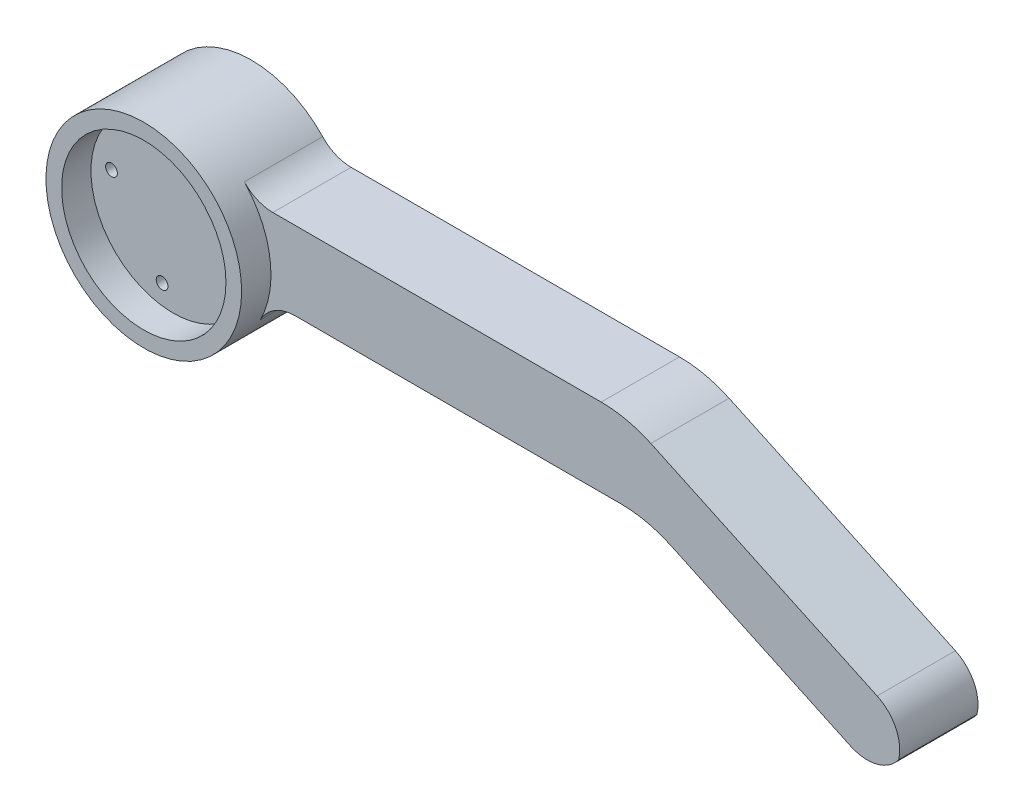
from build123d import *

# Parameters (mm, degrees)
BOSS_EXTRU_1_DEPTH  = 5
CONG_4_R            = 5
CONG_3_R            = 15
CONG_6_R            = 5
SKETCH4_R           = 0.75
CUT_EXTRUDE5_DEPTH  = 95.659933807
BOSS_EXTRUDE1_START = -13.75
SKETCH5_R           = 12.5
SKETCH5_R_2         = 10.5
BOSS_EXTRUDE1_DEPTH = 3.75


with BuildPart() as part:
    # Esquisse1 → Boss.-Extru.1 (new, symmetric)
    with BuildSketch(Plane.XY):
        with BuildLine():
            Line((10.356157589, 7), (58.01560049, 7))
            Line((58.01560049, 7), (94.472218138, -10))
            Line((94.472218138, -10), (91.091272045, -17.250462296))
            Line((91.091272045, -17.250462296), (60.53105703, -3))
            Line((60.53105703, -3), (12.1346611, -3))
            ThreePointArc((12.1346611, -3), (-12.306877399, -2.188782466), (10.356157589, 7))
        make_face()
    extrude(amount=BOSS_EXTRU_1_DEPTH, both=True)

    # Congé4
    cong_4_edges = [part.edges().sort_by_distance(p)[0] for p in [
        (12.1346611, -3, 0),
        (10.356157589, 7, 0),
    ]]
    fillet(cong_4_edges, radius=CONG_4_R)

    # Congé3
    cong_3_edges = [part.edges().sort_by_distance(p)[0] for p in [
        (60.53105703, -3, 0),
        (58.01560049, 7, 0),
    ]]
    fillet(cong_3_edges, radius=CONG_3_R)

    # Congé6
    # the kernel refuses this fillet: 5 mm, written as the material it takes off along each edge
    with BuildSketch(Plane(origin=(94.472218138, -10, 17.5), x_dir=(-0.906307787036649, 0.4226182617407012, 0), z_dir=(0, 0, -1)), Plane(origin=(91.091272045, -17.250462296, 17.5), x_dir=(0.4226182617407007, 0.9063077870366493, 0), z_dir=(0, 0, -1))) as cong_6_piece_1:
        with BuildLine():
            CenterArc((CONG_6_R, -CONG_6_R), CONG_6_R, 90, 90)
            Line((0, -CONG_6_R), (0, 0))
            Line((0, 0), (CONG_6_R, 0))
        make_face()
    extrude(amount=35, mode=Mode.SUBTRACT)

    # Sketch4 → Cut-Extrude5 (cut, through all)
    with BuildSketch(Plane(origin=(0, 0, -5), x_dir=(-1, 0, 0), z_dir=(0, 0, -1))):
        with Locations((-1.410466322, 7.874679978)):
            Circle(SKETCH4_R)
        with Locations((7.874679978, 1.410466322)):
            Circle(SKETCH4_R)
        with Locations((1.410466322, -7.874679978)):
            Circle(SKETCH4_R)
        with Locations((-7.874679978, -1.410466322)):
            Circle(SKETCH4_R)
    extrude(amount=-CUT_EXTRUDE5_DEPTH, mode=Mode.SUBTRACT)

    # Sketch5 → Boss-Extrude1 (add)
    with BuildSketch(Plane(origin=(0, 0, -5), x_dir=(-1, 0, 0), z_dir=(0, 0, -1)).offset(BOSS_EXTRUDE1_START)):
        with Locations(Location((0, 0, 0), (0, 0, 136.708192407))):
            Circle(SKETCH5_R)
        with Locations(Location((0, 0, 0), (0, 0, 180))):
            Circle(SKETCH5_R_2, mode=Mode.SUBTRACT)
    extrude(amount=BOSS_EXTRUDE1_DEPTH)


solid = part.part
